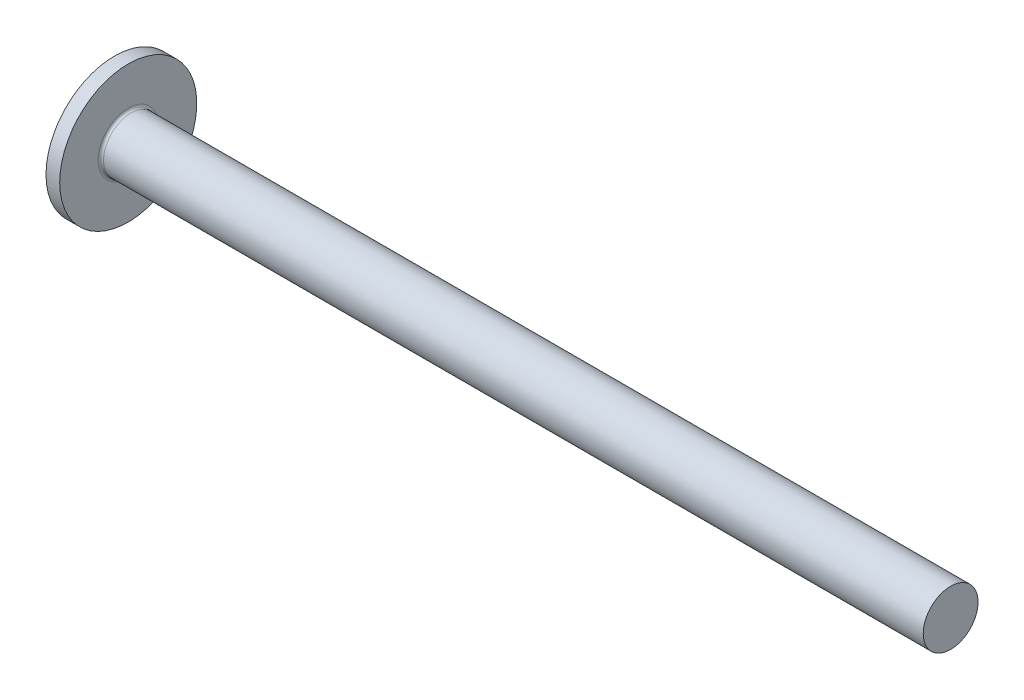
from build123d import *

# Parameters (mm, degrees)
RECPAT_COUNT = 2
RECPAT_ANGLE = 90


with BuildPart() as part:
    # Fillet1: read off the stored shape, not the designer's step
    # Fillet1 outline → Fillet1 (revolve)
    with BuildSketch(Plane.YX):
        with BuildLine():
            Line((2, 3.25), (2, 63.05))
            Line((2, 63.05), (0, 63.05))
            Line((0, 63.05), (0, 2.05))
            Line((0, 2.05), (5, 2.05))
            Line((5, 2.05), (5, 3.05))
            Line((5, 3.05), (2.2, 3.05))
            ThreePointArc((2.2, 3.05), (2.058578644, 3.108578644), (2, 3.25))
        make_face()
    revolve(axis=Axis((0, 0, 0), (1, 0, 0)))

    # PanSke → Pan (revolve)
    with BuildSketch(Plane.XY, mode=Mode.PRIVATE) as pan_sk:
        with BuildLine():
            Line((2.05, 4.424646879), (2.05, 0))
            Line((2.05, 0), (0, 0))
            ThreePointArc((0, 0), (0.537396082, 2.438237068), (2.05, 4.424646879))
        make_face()
    revolve(pan_sk.sketch.rotate(Axis((0, 0, 0), (1, 0, 0)), 90), axis=Axis((0, 0, 0), (1, 0, 0)))

    # Sketch3 → Recess section 0
    with BuildSketch(Plane(origin=(0, 0, 0), x_dir=(0, 0, -1), z_dir=(1, 0, 0))):
        with BuildLine():
            Line((-0.515, 2.15), (0.515, 2.15))
            Line((0.515, 2.15), (0.515, -2.15))
            Line((0.515, -2.15), (-0.515, -2.15))
            Line((-0.515, -2.15), (-0.515, 2.15))
        make_face()
    # Sketch4 → Recess section 1
    with BuildSketch(Plane(origin=(2.34, 0, 0), x_dir=(0, 0, -1), z_dir=(1, 0, 0))):
        with BuildLine():
            Line((-0.515, 2.106524682), (0.515, 2.106524682))
            Line((0.515, 2.106524682), (0.515, -2.106524682))
            Line((0.515, -2.106524682), (-0.515, -2.106524682))
            Line((-0.515, -2.106524682), (-0.515, 2.106524682))
        make_face()
    recess = loft(mode=Mode.SUBTRACT)

    # RecPat: Recess ×2 about axis
    recpat_axis = Axis((0, 0, 0), (1, 0, 0))
    for i in range(1, RECPAT_COUNT):
        add(recess.rotate(recpat_axis, i * RECPAT_ANGLE / (RECPAT_COUNT - 1)), mode=Mode.SUBTRACT)

    # RecCorSke → RecessCore (revolve, cut)
    with BuildSketch(Plane.XY, mode=Mode.PRIVATE) as recesscore_sk:
        Polygon((0, 0), (0, 1.172663335), (4.6, 0.851), (4.876506661, 0), align=None)
    revolve(recesscore_sk.sketch.rotate(Axis((-3.175, 0, 0), (1, 0, 0)), 90), axis=Axis((-3.175, 0, 0), (1, 0, 0)), mode=Mode.SUBTRACT)


solid = part.part
